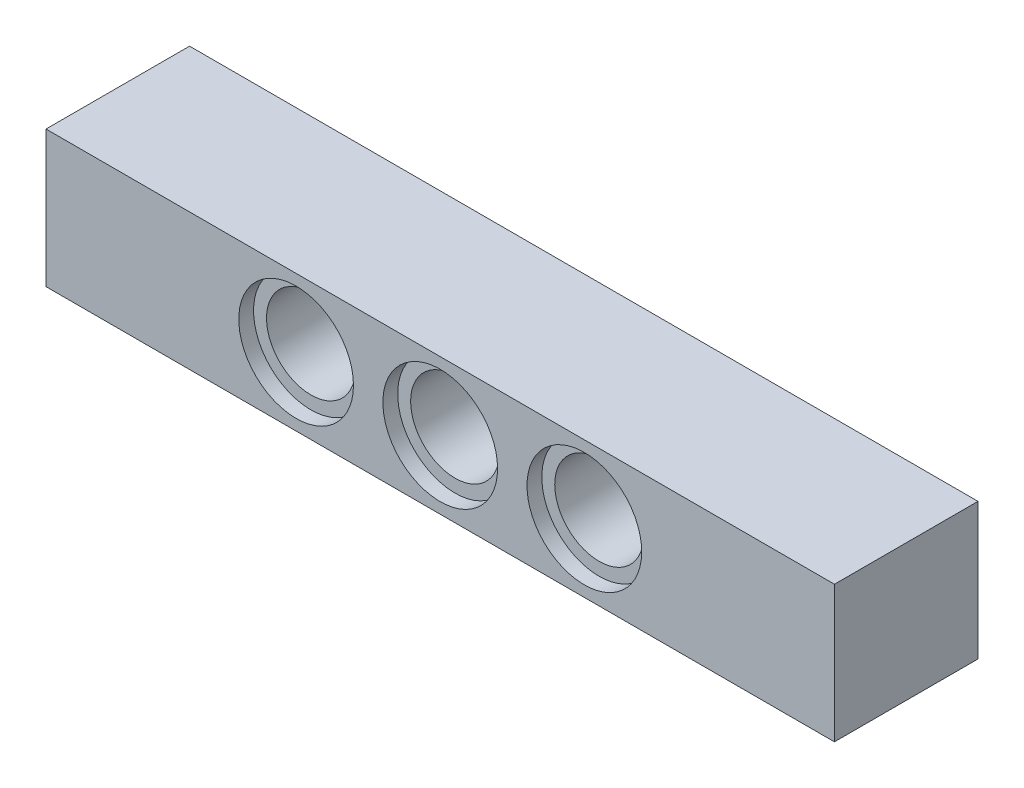
from build123d import *

# Parameters (mm, degrees)
SKETCH1_W                = 39
SKETCH1_H                = 7.38
BOSS_EXTRUDE1_DEPTH      = 7.76
SKETCH2_R                = 2.4
CUT_EXTRUDE1_DEPTH       = 7.76
CUT_EXTRUDE2_OUTLINE_R   = 3.1
CUT_EXTRUDE2_OUTLINE_R_2 = 2.4
CUT_EXTRUDE2_DEPTH       = 0.8
CUT_EXTRUDE3_START       = 6.96
CUT_EXTRUDE3_OUTLINE_R   = 3.1
CUT_EXTRUDE3_OUTLINE_R_2 = 2.4
CUT_EXTRUDE3_DEPTH       = 0.8
LPATTERN3_COUNT          = 3
LPATTERN3_PITCH          = 7.79
LPATTERN6_COUNT          = 3
LPATTERN6_PITCH          = 7.79
FILLET1_R                = 3.69
FILLET2_R                = 3.69
FILLET3_R                = 3.69
FILLET4_R                = 3.69
BOSS_EXTRUDE2_START      = -7.76
SKETCH3_R                = 3.1
BOSS_EXTRUDE2_DEPTH      = 7.76
SKETCH4_R                = 3.1
BOSS_EXTRUDE3_DEPTH      = 7.76
SKETCH5_W                = 5.5
SKETCH5_H                = 7.38
BOSS_EXTRUDE5_DEPTH      = 7.76


# Read off the part's stored shape, not the designer's step: Cut-Extrude2, Cut-Extrude3
with BuildPart() as part:
    # Sketch1 → Boss-Extrude1 (new body)
    with BuildSketch(Plane.XY):
        with Locations((19.5, 3.69)):
            Rectangle(SKETCH1_W, SKETCH1_H)
    extrude(amount=BOSS_EXTRUDE1_DEPTH)

    # Sketch2 → Cut-Extrude1 (cut)
    with BuildSketch(Plane.XY.offset(7.76)):
        with Locations((19.5, 3.69)):
            Circle(SKETCH2_R)
    cut_extrude1 = extrude(amount=-CUT_EXTRUDE1_DEPTH, mode=Mode.SUBTRACT)

    # Cut-Extrude2 outline → Cut-Extrude2 (cut)
    with BuildSketch(Plane.XY):
        with Locations((19.5, 3.69)):
            Circle(CUT_EXTRUDE2_OUTLINE_R)
        with Locations((19.5, 3.69)):
            Circle(CUT_EXTRUDE2_OUTLINE_R_2, mode=Mode.SUBTRACT)
    cut_extrude2 = extrude(amount=CUT_EXTRUDE2_DEPTH, mode=Mode.SUBTRACT)

    # Cut-Extrude3 outline → Cut-Extrude3 (cut)
    with BuildSketch(Plane.XY.offset(CUT_EXTRUDE3_START)):
        with Locations((19.5, 3.69)):
            Circle(CUT_EXTRUDE3_OUTLINE_R)
        with Locations((19.5, 3.69)):
            Circle(CUT_EXTRUDE3_OUTLINE_R_2, mode=Mode.SUBTRACT)
    cut_extrude3 = extrude(amount=CUT_EXTRUDE3_DEPTH, mode=Mode.SUBTRACT)

    # LPattern3: Cut-Extrude1, Cut-Extrude2, Cut-Extrude3 ×3
    with Locations(*[(-i * LPATTERN3_PITCH, 0, 0) for i in range(1, LPATTERN3_COUNT)]):
        add(cut_extrude1, mode=Mode.SUBTRACT)
        add(cut_extrude2, mode=Mode.SUBTRACT)
        add(cut_extrude3, mode=Mode.SUBTRACT)

    # LPattern6: Cut-Extrude1, Cut-Extrude2, Cut-Extrude3 ×3
    with Locations(*[(i * LPATTERN6_PITCH, 0, 0) for i in range(1, LPATTERN6_COUNT)]):
        add(cut_extrude1, mode=Mode.SUBTRACT)
        add(cut_extrude2, mode=Mode.SUBTRACT)
        add(cut_extrude3, mode=Mode.SUBTRACT)

    # Fillet1
    fillet1_edges = [part.edges().sort_by_distance(p)[0] for p in [
        (0, 7.38, 3.88),
    ]]
    fillet(fillet1_edges, radius=FILLET1_R)

    # Fillet2
    fillet2_edges = [part.edges().sort_by_distance(p)[0] for p in [
        (0, 0, 3.88),
    ]]
    fillet(fillet2_edges, radius=FILLET2_R - 0.0001)  # a hair under: the kernel refuses the full size

    # Fillet3
    fillet3_edges = [part.edges().sort_by_distance(p)[0] for p in [
        (39, 7.38, 3.88),
    ]]
    fillet(fillet3_edges, radius=FILLET3_R)

    # Fillet4
    fillet4_edges = [part.edges().sort_by_distance(p)[0] for p in [
        (39, 0, 3.88),
    ]]
    fillet(fillet4_edges, radius=FILLET4_R - 0.0001)  # a hair under: the kernel refuses the full size

    # Sketch3 → Boss-Extrude2 (add)
    with BuildSketch(Plane.XY.offset(7.76).offset(BOSS_EXTRUDE2_START)):
        with Locations((3.92, 3.69)):
            Circle(SKETCH3_R)
    extrude(amount=BOSS_EXTRUDE2_DEPTH)

    # Sketch4 → Boss-Extrude3 (add)
    with BuildSketch(Plane(origin=(0, 0, 0), x_dir=(-1, 0, 0), z_dir=(0, 0, -1))):
        with Locations((-35.08, 3.69)):
            Circle(SKETCH4_R)
    extrude(amount=-BOSS_EXTRUDE3_DEPTH)

    # Sketch5 → Boss-Extrude5 (add)
    with BuildSketch(Plane(origin=(0, 0, 0), x_dir=(-1, 0, 0), z_dir=(0, 0, -1))):
        with Locations((-38.06, 3.69)):
            Rectangle(SKETCH5_W, SKETCH5_H)
        with Locations((-0.94, 3.69)):
            Rectangle(SKETCH5_W, SKETCH5_H)
    extrude(amount=-BOSS_EXTRUDE5_DEPTH)


solid = part.part
